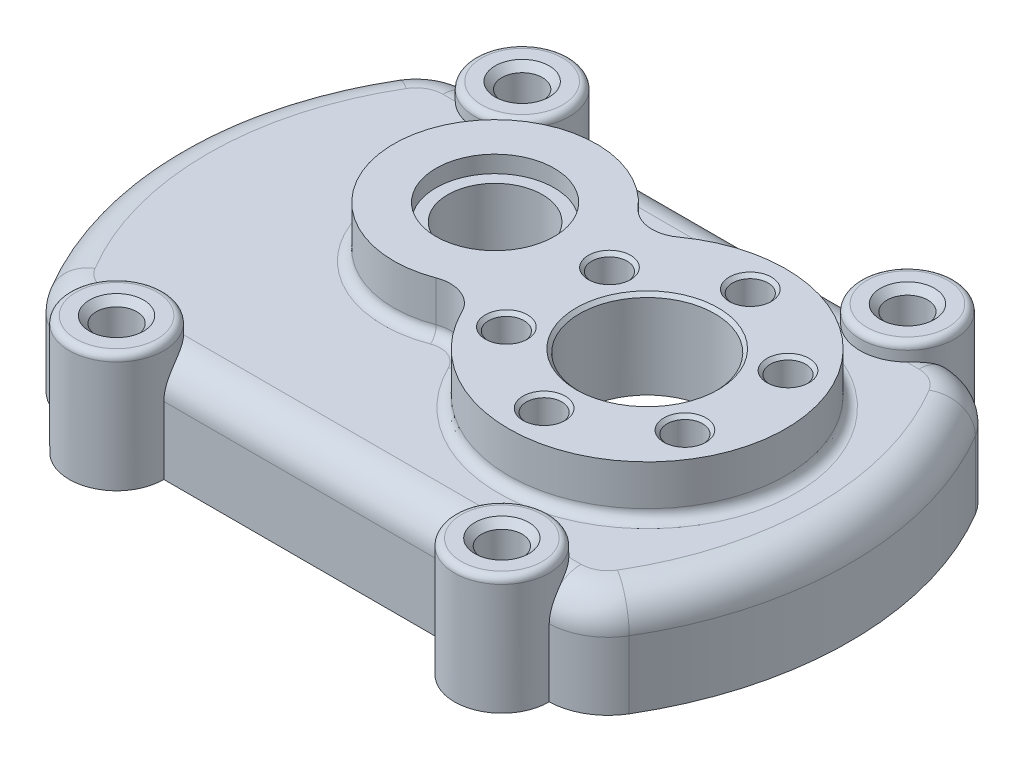
from build123d import *
from build123d.topology import SkipClean

# Parameters (mm, degrees)
BOSS_EXTRUDE1_DEPTH                     = 30
FILLET1_R                               = 18
FILLET2_R                               = 10
SHELL1_T                                = -6
SKETCH2_R                               = 14
BOSS_EXTRUDE2_DEPTH                     = 35
F_59_64_0_92188_DIAMETER_HOLE1_D        = 11.999214
FILLET3_R                               = 2
CHAMFER1_SIZE                           = 2
LPATTERN1_COUNT                         = 2
LPATTERN1_PITCH                         = 114
FILLET3_OF_LPATTERN1_R                  = 2
CHAMFER1_OF_LPATTERN1_SIZE              = 2
MIRROR1_OUTLINE_R                       = 5.999607
MIRROR1_DEPTH                           = 30
MIRROR1_4_DEPTH                         = 29.883524815
MIRROR1_5_OUTLINE_W                     = 5.999607
MIRROR1_5_OUTLINE_H                     = 35
MIRROR1_6_OUTLINE_W                     = 5.999607
MIRROR1_6_OUTLINE_H                     = 35
BOSS_EXTRUDE3_DEPTH                     = 15
SKETCH12_R                              = 25
SKETCH12_R_2                            = 19
BOSS_EXTRUDE4_DEPTH                     = 5
F_1_0MM_DOWEL_HOLE1_D                   = 40
CBORE_FOR_M5_HEX_HEAD_BOLT2_D           = 28
CBORE_FOR_M5_HEX_HEAD_BOLT2_CBORE_D     = 35
CBORE_FOR_M5_HEX_HEAD_BOLT2_CBORE_DEPTH = 5
FILLET4_R                               = 3
CHAMFER2_SIZE                           = 1
CIRPATTERN1_COUNT                       = 6
CHAMFER2_OF_CIRPATTERN1_SIZE            = 1
CHAMFER3_SIZE                           = 1


# Read off the part's stored shape, not the designer's step: Mirror1
with BuildPart() as part:
    # Sketch1 → Boss-Extrude1 (new body)
    with BuildSketch(Plane(origin=(0, 0, 0), x_dir=(1, 0, 0), z_dir=(0, 1, 0))):
        with BuildLine():
            Line((-80, 60), (80, 60))
            ThreePointArc((80, 60), (100, 0), (80, -60))
            Line((80, -60), (-80, -60))
            ThreePointArc((-80, -60), (-100, 0), (-80, 60))
        make_face()
    extrude(amount=BOSS_EXTRUDE1_DEPTH)

    # Fillet1
    fillet1_edges = [part.edges().sort_by_distance(p)[0] for p in [
        (-80, 15, -60),
        (80, 15, -60),
        (80, 15, 60),
        (-80, 15, 60),
    ]]
    fillet(fillet1_edges, radius=FILLET1_R)

    # Fillet2
    fillet2_edges = [part.edges().sort_by_distance(p)[0] for p in [
        (0, 30, 60),
        (-100, 30, 0),
        (100, 30, 0),
        (0, 30, -60),
        (79.316833816, 30, 57.651696705),
        (79.316833816, 30, -57.651696705),
        (-79.316833816, 30, -57.651696705),
        (-79.316833816, 30, 57.651696705),
    ]]
    fillet(fillet2_edges, radius=FILLET2_R)

    # Shell1
    shell1_openings = [part.faces().sort_by_distance(p)[0] for p in [
        (0, 0, 0),
    ]]
    offset(amount=SHELL1_T, openings=shell1_openings, kind=Kind.INTERSECTION)

    # Sketch2 → Boss-Extrude2 (add)
    with BuildSketch(Plane.XZ):
        with Locations(Location((-57, 60, 0), (0, 0, 270))):
            Circle(SKETCH2_R)
    boss_extrude2 = extrude(amount=-BOSS_EXTRUDE2_DEPTH)

    # 59/64 (0.92188) Diameter Hole1 (through all)
    with Locations(Plane(origin=(-57, 35, 60), x_dir=(0, 0, 1), z_dir=(0, 1, 0))):
        with Locations((0, 0)):
            f_59_64_0_92188_diameter_hole1 = Hole(F_59_64_0_92188_DIAMETER_HOLE1_D / 2)

    # Fillet3
    fillet3_edges = [part.edges().sort_by_distance(p)[0] for p in [
        (-57, 35, 74),
    ]]
    fillet(fillet3_edges, radius=FILLET3_R)

    # Chamfer1
    chamfer1_edges = [part.edges().sort_by_distance(p)[0] for p in [
        (-57, 35, 65.999607),
    ]]
    chamfer(chamfer1_edges, length=CHAMFER1_SIZE)

    # LPattern1: Boss-Extrude2, 59/64 (0.92188) Diameter Hole1 ×2
    with Locations(*[(i * LPATTERN1_PITCH, 0, 0) for i in range(1, LPATTERN1_COUNT)]):
        add(boss_extrude2)
        add(f_59_64_0_92188_diameter_hole1, mode=Mode.SUBTRACT)

    # Fillet3 of LPattern1
    fillet3_of_lpattern1_edges = [part.edges().sort_by_distance(p)[0] for p in [
        (57, 35, 74),
    ]]
    fillet(fillet3_of_lpattern1_edges, radius=FILLET3_OF_LPATTERN1_R)

    # Chamfer1 of LPattern1
    chamfer1_of_lpattern1_edges = [part.edges().sort_by_distance(p)[0] for p in [
        (57, 35, 65.999607),
    ]]
    chamfer(chamfer1_of_lpattern1_edges, length=CHAMFER1_OF_LPATTERN1_SIZE)

    # Mirror1 outline → Mirror1 (add)
    # profile 1 of 2: a face of its own
    with BuildSketch(Plane(origin=(0, 0, 0), x_dir=(1, 0, 0), z_dir=(0, 1, 0))):
        with BuildLine():
            ThreePointArc((-69.649113316, 54.000005641), (-57.000001329, 46), (-44.350887823, 54.00000324))
            ThreePointArc((-44.350887823, 54.00000324), (-56.999999336, 74), (-69.649113316, 54.000005641))
        make_face()
        with Locations((-57, 60)):
            Circle(MIRROR1_OUTLINE_R, mode=Mode.SUBTRACT)
    # profile 2 of 2: a face of its own
    with BuildSketch(Plane(origin=(0, 0, 0), x_dir=(1, 0, 0), z_dir=(0, 1, 0))):
        with BuildLine():
            ThreePointArc((44.350889294, 54.000000137), (56.999999924, 46), (69.649110641, 54))
            ThreePointArc((69.649110641, 54), (57.000000038, 74), (44.350889294, 54.000000137))
        make_face()
        with Locations((57, 60)):
            Circle(MIRROR1_OUTLINE_R, mode=Mode.SUBTRACT)
    extrude(amount=MIRROR1_DEPTH)

    # Mirror1 2 outline → Mirror1 2 (revolve)
    with SkipClean():  # the faces are left unmerged after this step: merging them gives an invalid solid
        with BuildSketch(Plane(origin=(-57, 0, -60), x_dir=(1, 0, 0), z_dir=(0, 0, 1))):
            with BuildLine():
                Line((12, 35), (7.999607, 35))
                Line((7.999607, 35), (5.999607, 33))
                Line((5.999607, 33), (5.999607, 0))
                Line((5.999607, 0), (14, 0))
                Line((14, 0), (14, 33))
                ThreePointArc((14, 33), (13.414213562, 34.414213562), (12, 35))
            make_face()
        revolve(axis=Axis((-57, 0, -60), (0, 1, 0)))

    # Mirror1 3 outline → Mirror1 3 (revolve)
    with SkipClean():  # the faces are left unmerged after this step: merging them gives an invalid solid
        with BuildSketch(Plane(origin=(57, 0, -60), x_dir=(1, 0, 0), z_dir=(0, 0, 1))):
            with BuildLine():
                Line((12, 35), (7.999607, 35))
                Line((7.999607, 35), (5.999607, 33))
                Line((5.999607, 33), (5.999607, 0))
                Line((5.999607, 0), (14, 0))
                Line((14, 0), (14, 33))
                ThreePointArc((14, 33), (13.414213562, 34.414213562), (12, 35))
            make_face()
        revolve(axis=Axis((57, 0, -60), (0, 1, 0)))

    # Mirror1 4 outline → Mirror1 4 (cut)
    with SkipClean():  # the faces are left unmerged after this step: merging them gives an invalid solid
        with BuildSketch(Plane(origin=(0, 0, 0), x_dir=(1, 0, 0), z_dir=(0, 1, 0))):
            with BuildLine():
                ThreePointArc((-62.999607, 60), (-57, 54.000393), (-51.000393, 60))
                Line((-51.000393, 60), (-62.999607, 60))
            make_face()
            with BuildLine():
                Line((62.999607, 60), (51.000393, 60))
                ThreePointArc((51.000393, 60), (57, 54.000393), (62.999607, 60))
            make_face()
        extrude(amount=MIRROR1_4_DEPTH, mode=Mode.SUBTRACT)

    # Mirror1 5 outline → Mirror1 5 (revolve, cut)
    with SkipClean():  # the faces are left unmerged after this step: merging them gives an invalid solid
        with BuildSketch(Plane(origin=(-57, 0, -60), x_dir=(1, 0, 0), z_dir=(0, 0, 1))):
            with Locations((2.9998035, 17.5)):
                Rectangle(MIRROR1_5_OUTLINE_W, MIRROR1_5_OUTLINE_H)
        revolve(axis=Axis((-57, 0, -60), (0, 1, 0)), mode=Mode.SUBTRACT)

    # Mirror1 6 outline → Mirror1 6 (revolve, cut)
    with SkipClean():  # the faces are left unmerged after this step: merging them gives an invalid solid
        with BuildSketch(Plane(origin=(57, 0, -60), x_dir=(1, 0, 0), z_dir=(0, 0, 1))):
            with Locations((2.9998035, 17.5)):
                Rectangle(MIRROR1_6_OUTLINE_W, MIRROR1_6_OUTLINE_H)
        revolve(axis=Axis((57, 0, -60), (0, 1, 0)), mode=Mode.SUBTRACT)

    # Sketch11 → Boss-Extrude3 (add)
    with SkipClean():  # the faces are left unmerged after this step: merging them gives an invalid solid
        with BuildSketch(Plane(origin=(0, 30, 0), x_dir=(1, 0, 0), z_dir=(0, 1, 0))):
            with BuildLine():
                ThreePointArc((3.166776615, -18.008710533), (79.775842506, -9.943960626), (15.974784323, 33.223320299))
                ThreePointArc((15.974784323, 33.223320299), (8.985746764, 31.390531603), (2.586231716, 34.744926864))
                ThreePointArc((2.586231716, 34.744926864), (-49.104275004, 22.276068751), (-9.362702304, -13.050809217))
                ThreePointArc((-9.362702304, -13.050809217), (-2.137532433, -13.102585185), (3.166776615, -18.008710533))
            make_face()
        extrude(amount=BOSS_EXTRUDE3_DEPTH)

    # Sketch12 → Boss-Extrude4 (add)
    with SkipClean():  # the faces are left unmerged after this step: merging them gives an invalid solid
        with BuildSketch(Plane.XZ.offset(-24)):
            with Locations(Location((40, 0, 0), (0, 0, 90))):
                Circle(SKETCH12_R)
            with Locations(Location((-20, -15, 0), (0, 0, 90))):
                Circle(SKETCH12_R_2)
        extrude(amount=BOSS_EXTRUDE4_DEPTH)

    # Ø1.0mm Dowel Hole1 (through all)
    with Locations(Plane(origin=(40, 45, 0), x_dir=(0, 0, 1), z_dir=(0, 1, 0))):
        with Locations((0, 0)):
            Hole(F_1_0MM_DOWEL_HOLE1_D / 2)

    # CBORE for M5 Hex Head Bolt2 (through all)
    with Locations(Plane(origin=(-20, 45, -15), x_dir=(0, 0, 1), z_dir=(0, 1, 0))):
        with Locations((0, 0)):
            CounterBoreHole(CBORE_FOR_M5_HEX_HEAD_BOLT2_D / 2, CBORE_FOR_M5_HEX_HEAD_BOLT2_CBORE_D / 2, CBORE_FOR_M5_HEX_HEAD_BOLT2_CBORE_DEPTH)

    # Fillet4
    fillet4_edges = [part.edges().sort_by_distance(p)[0] for p in [
        (-2.137532433, 30, 13.102585185),
        (79.775842506, 30, 9.943960626),
        (8.985746764, 30, -31.390531603),
        (-49.104275004, 30, -22.276068751),
    ]]
    fillet(fillet4_edges, radius=FILLET4_R)

    # Sketch19 → Tap Drill for M12x1.5 Tap1 (revolve, cut)
    with SkipClean():  # the faces are left unmerged after this step: merging them gives an invalid solid
        with BuildSketch(Plane(origin=(40, 45, -30.5), x_dir=(0, 0, 1), z_dir=(1, 0, 0))):
            Polygon((0, 0), (0, 18.15451825), (5.25, 15), (5.25, 0), align=None)
        tap_drill_for_m12x1_5_tap1 = revolve(axis=Axis((40, 51.35, -30.5), (0, -1, 0)), mode=Mode.SUBTRACT)

    # Chamfer2
    chamfer2_edges = [part.edges().sort_by_distance(p)[0] for p in [
        (40, 45, -35.75),
    ]]
    chamfer(chamfer2_edges, length=CHAMFER2_SIZE)

    # CirPattern1: Tap Drill for M12x1.5 Tap1 ×6 about axis
    with SkipClean():  # the faces are left unmerged after this step: merging them gives an invalid solid
        cirpattern1_axis = Axis((40, 0, 0), (0, 1, 0))
        for i in range(1, CIRPATTERN1_COUNT):
            add(tap_drill_for_m12x1_5_tap1.rotate(cirpattern1_axis, i * 360 / CIRPATTERN1_COUNT), mode=Mode.SUBTRACT)

    # Chamfer2 of CirPattern1
    chamfer2_of_cirpattern1_edges = [part.edges().sort_by_distance(p)[0] for p in [
        (9.039591815, 45, -17.875),
        (9.039591815, 45, 17.875),
        (40, 45, 35.75),
        (70.960408185, 45, 17.875),
        (70.960408185, 45, -17.875),
    ]]
    chamfer(chamfer2_of_cirpattern1_edges, length=CHAMFER2_OF_CIRPATTERN1_SIZE)

    # Chamfer3
    chamfer3_edges = [part.edges().sort_by_distance(p)[0] for p in [
        (40, 45, 20),
    ]]
    chamfer(chamfer3_edges, length=CHAMFER3_SIZE)


solid = part.part
